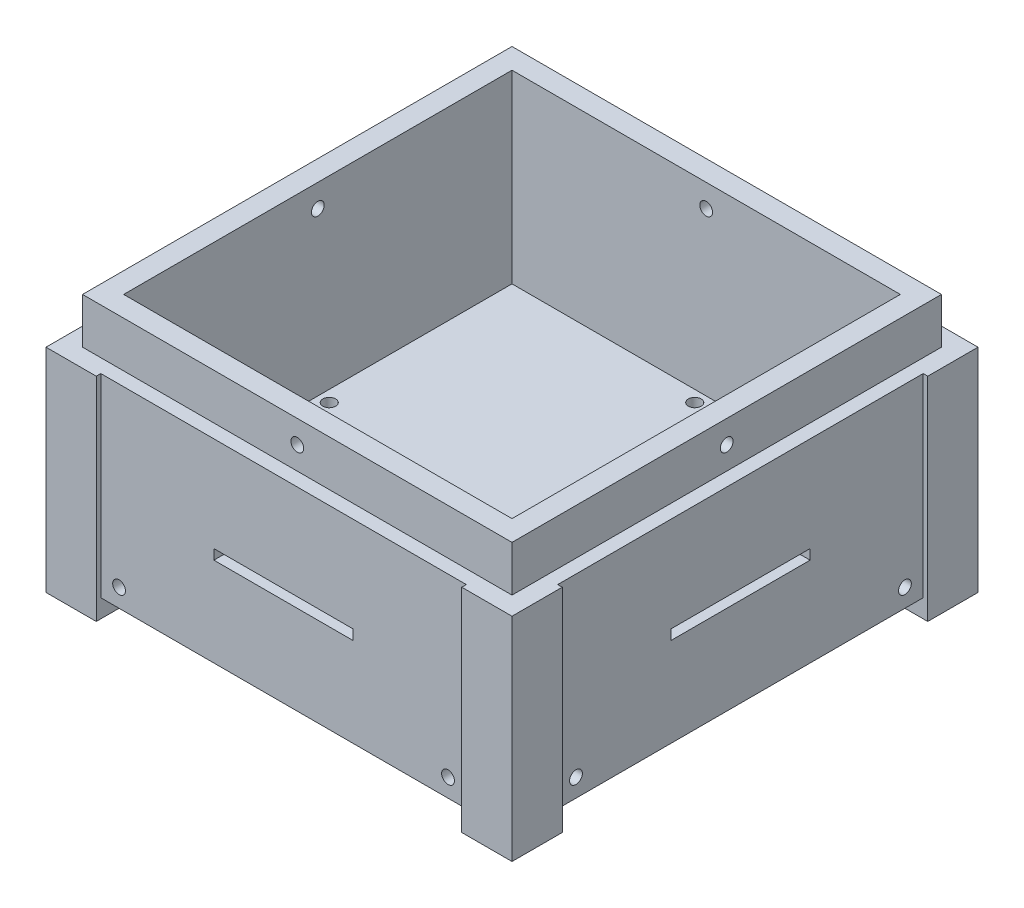
from build123d import *

# Parameters (mm, degrees)
SKETCH1_W                       = 100
SKETCH1_H                       = 100
BOSS_EXTRUDE1_DEPTH             = 95
SKETCH2_W                       = 10
SKETCH2_H                       = 10
BOSS_EXTRUDE2_DEPTH             = 105
SKETCH3_R                       = 1.4
CUT_EXTRUDE1_DEPTH              = 10
SKETCH4_W                       = 11
SKETCH4_H                       = 11
BOSS_EXTRUDE3_DEPTH             = 105
SKETCH5_R                       = 1.4
CUT_EXTRUDE2_DEPTH              = 10
SKETCH6_R                       = 1.4
CUT_EXTRUDE3_DEPTH              = 10
CHAMFER1_SIZE                   = 1
SKETCH7_W                       = 19
SKETCH7_H                       = 43
SKETCH7_W_2                     = 16
SKETCH7_H_2                     = 40
BOSS_EXTRUDE4_DEPTH             = 3
SKETCH8_W                       = 16
SKETCH8_H                       = 40
CUT_EXTRUDE4_DEPTH              = 10
CHAMFER2_SIZE                   = 13
SKETCH9_W                       = 16
SKETCH9_H                       = 3.1
CUT_EXTRUDE5_DEPTH              = 10
FILLET1_R                       = 1
SKETCH10_R                      = 1.4
CUT_EXTRUDE6_DEPTH              = 10
SKETCH12_W                      = 30.5
SKETCH12_H                      = 2.2
CUT_EXTRUDE7_DEPTH              = 3
SKETCH13_W                      = 30.5
SKETCH13_H                      = 2.2
CUT_EXTRUDE8_DEPTH              = 3
SKETCH14_W                      = 2.2
SKETCH14_H                      = 30.5
CUT_EXTRUDE9_DEPTH              = 3
CUT_EXTRUDE10_DEPTH             = 45
CUT_EXTRUDE10_DEPTH_BACK        = 45
SKETCH15_W                      = 90
SKETCH15_H                      = 58
CUT_EXTRUDE11_REACH             = 125.296
CUT_EXTRUDE11_DIRECTION_2_REACH = 125.296
CHAMFER3_SIZE                   = 4
CUT_EXTRUDE12_DEPTH             = 152.673992497
BOSS_EXTRUDE7_DEPTH             = 10
BOSS_EXTRUDE7_DEPTH_BACK        = 30.5
SKETCH19_W                      = 94
SKETCH19_H                      = 94
SKETCH19_W_2                    = 85
SKETCH19_H_2                    = 85
SKETCH20_R                      = 1.4
CUT_EXTRUDE13_DEPTH             = 123.316188626
SKETCH21_R                      = 1.4
CUT_EXTRUDE14_DEPTH             = 123.316188626
SKETCH22_W                      = 2.2
SKETCH22_H                      = 30.5
BOSS_EXTRUDE8_DEPTH             = 3
SKETCH23_R                      = 1.4
CUT_EXTRUDE15_DEPTH             = 20


with BuildPart() as part:
    # Sketch1 → Boss-Extrude1 (new body)
    with BuildSketch(Plane(origin=(0, 0, 0), x_dir=(1, 0, 0), z_dir=(0, 1, 0))):
        Rectangle(SKETCH1_W, SKETCH1_H)
    extrude(amount=BOSS_EXTRUDE1_DEPTH)

    # Sketch2 → Boss-Extrude2 (add)
    with BuildSketch(Plane(origin=(0, 100, 0), x_dir=(1, 0, 0), z_dir=(0, 1, 0))):
        with Locations((-45, 45)):
            Rectangle(SKETCH2_W, SKETCH2_H)
        with Locations((45, 45)):
            Rectangle(SKETCH2_W, SKETCH2_H)
        with Locations((45, -45)):
            Rectangle(SKETCH2_W, SKETCH2_H)
        with Locations((-45, -45)):
            Rectangle(SKETCH2_W, SKETCH2_H)
    extrude(amount=-BOSS_EXTRUDE2_DEPTH)

    # Sketch3 → Cut-Extrude1 (cut)
    with BuildSketch(Plane(origin=(0, 95, 0), x_dir=(1, 0, 0), z_dir=(0, 1, 0))):
        with Locations(Location((-28, -45, 0), (0, 0, 270))):
            Circle(SKETCH3_R)
        with Locations(Location((28, -45, 0), (0, 0, 90))):
            Circle(SKETCH3_R)
        with Locations(Location((28, 45, 0), (0, 0, 270))):
            Circle(SKETCH3_R)
        with Locations(Location((-28, 45, 0), (0, 0, 90))):
            Circle(SKETCH3_R)
    cut_extrude1 = extrude(amount=-CUT_EXTRUDE1_DEPTH, mode=Mode.SUBTRACT)

    # Sketch4 → Boss-Extrude3 (add)
    with BuildSketch(Plane(origin=(0, 100, 0), x_dir=(1, 0, 0), z_dir=(0, 1, 0))):
        with Locations((-45.5, 45.5)):
            Rectangle(SKETCH4_W, SKETCH4_H)
        with Locations((45.5, 45.5)):
            Rectangle(SKETCH4_W, SKETCH4_H)
        with Locations((45.5, -45.5)):
            Rectangle(SKETCH4_W, SKETCH4_H)
        with Locations((-45.5, -45.5)):
            Rectangle(SKETCH4_W, SKETCH4_H)
    extrude(amount=-BOSS_EXTRUDE3_DEPTH)

    # Sketch5 → Cut-Extrude2 (cut)
    with BuildSketch(Plane.XY.offset(50)):
        with Locations((-36, 91)):
            Circle(SKETCH5_R)
        with Locations(Location((36, 91, 0), (0, 0, 180))):
            Circle(SKETCH5_R)
        with Locations((36, 4)):
            Circle(SKETCH5_R)
        with Locations(Location((-36, 4, 0), (0, 0, 180))):
            Circle(SKETCH5_R)
    cut_extrude2 = extrude(amount=-CUT_EXTRUDE2_DEPTH, mode=Mode.SUBTRACT)

    # Mirror1: Cut-Extrude2 across plane
    add(cut_extrude2.mirror(Plane.XY), mode=Mode.SUBTRACT)

    # Sketch6 → Cut-Extrude3 (cut)
    with BuildSketch(Plane.ZY.offset(50)):
        with Locations((-36, 91)):
            Circle(SKETCH6_R)
        with Locations(Location((36, 91, 0), (0, 0, 180))):
            Circle(SKETCH6_R)
        with Locations((36, 4)):
            Circle(SKETCH6_R)
        with Locations(Location((-36, 4, 0), (0, 0, 180))):
            Circle(SKETCH6_R)
    cut_extrude3 = extrude(amount=-CUT_EXTRUDE3_DEPTH, mode=Mode.SUBTRACT)

    # Mirror2: Cut-Extrude3 across plane
    add(cut_extrude3.mirror(Plane(origin=(0, 0, 0), x_dir=(0, 0, 1), z_dir=(1, 0, 0))), mode=Mode.SUBTRACT)

    # Mirror3: Cut-Extrude1 across plane
    add(cut_extrude1.mirror(Plane.ZX.offset(47.5)), mode=Mode.SUBTRACT)

    # Chamfer1
    chamfer1_edges = [part.edges().sort_by_distance(p)[0] for p in [
        (-45.5, -5, 51),
        (-51, -5, 45.5),
        (-51, 100, 45.5),
        (-45.5, 100, 51),
        (51, -5, 45.5),
        (45.5, -5, 51),
        (45.5, 100, 51),
        (51, 100, 45.5),
        (45.5, -5, -51),
        (51, -5, -45.5),
        (51, 100, -45.5),
        (45.5, 100, -51),
        (-51, -5, -45.5),
        (-45.5, -5, -51),
        (-45.5, 100, -51),
        (-51, 100, -45.5),
        (-45.5, -5, 40),
        (-40, -5, 45.5),
        (-40, 100, 45.5),
        (-45.5, 100, 40),
        (40, -5, 45.5),
        (45.5, -5, 40),
        (45.5, 100, 40),
        (40, 100, 45.5),
        (45.5, -5, -40),
        (40, -5, -45.5),
        (45, 95, -40),
        (40, 100, -45.5),
        (45.5, 100, -40),
        (-40, -5, -45.5),
        (-45.5, -5, -40),
        (-45.5, 100, -40),
        (-40, 100, -45.5),
    ]]
    chamfer(chamfer1_edges, length=CHAMFER1_SIZE)

    # Sketch7 → Boss-Extrude4 (add)
    with BuildSketch(Plane(origin=(0, 95, 0), x_dir=(1, 0, 0), z_dir=(0, 1, 0))):
        with Locations((0, -17)):
            Rectangle(SKETCH7_W, SKETCH7_H)
        with Locations((0, -17)):
            Rectangle(SKETCH7_W_2, SKETCH7_H_2, mode=Mode.SUBTRACT)
    extrude(amount=BOSS_EXTRUDE4_DEPTH)

    # Sketch8 → Cut-Extrude4 (cut)
    with BuildSketch(Plane(origin=(0, 95, 0), x_dir=(1, 0, 0), z_dir=(0, 1, 0))):
        with Locations((0, -17)):
            Rectangle(SKETCH8_W, SKETCH8_H)
    extrude(amount=-CUT_EXTRUDE4_DEPTH, mode=Mode.SUBTRACT)

    # Chamfer2
    chamfer2_edges = [part.edges().sort_by_distance(p)[0] for p in [
        (0, 85, 37),
    ]]
    chamfer(chamfer2_edges, length=CHAMFER2_SIZE - 0.0001)  # a hair under: the kernel refuses the full size

    # Sketch9 → Cut-Extrude5 (cut)
    with BuildSketch(Plane(origin=(0, 85, 0), x_dir=(1, 0, 0), z_dir=(0, 1, 0))):
        with Locations((0, 1.45)):
            Rectangle(SKETCH9_W, SKETCH9_H)
    extrude(amount=-CUT_EXTRUDE5_DEPTH, mode=Mode.SUBTRACT)

    # Fillet1
    fillet1_edges = [part.edges().sort_by_distance(p)[0] for p in [
        (0, 85, 0.1),
    ]]
    fillet(fillet1_edges, radius=FILLET1_R)

    # Sketch10 → Cut-Extrude6 (cut)
    with BuildSketch(Plane.XY.offset(-3)):
        with Locations((0, 92)):
            Circle(SKETCH10_R)
    extrude(amount=-CUT_EXTRUDE6_DEPTH, mode=Mode.SUBTRACT)

    # Sketch12 → Cut-Extrude7 (cut)
    with BuildSketch(Plane.ZY.offset(50)):
        with Locations((0, 74.4)):
            Rectangle(SKETCH12_W, SKETCH12_H)
        with Locations((0, 20.6)):
            Rectangle(SKETCH12_W, SKETCH12_H)
    cut_extrude7 = extrude(amount=-CUT_EXTRUDE7_DEPTH, mode=Mode.SUBTRACT)

    # Mirror4: Cut-Extrude7 across plane
    add(cut_extrude7.mirror(Plane(origin=(0, 0, 0), x_dir=(0, 0, 1), z_dir=(1, 0, 0))), mode=Mode.SUBTRACT)

    # Sketch13 → Cut-Extrude8 (cut)
    with BuildSketch(Plane.XY.offset(50)):
        with Locations((0, 74.4)):
            Rectangle(SKETCH13_W, SKETCH13_H)
        with Locations((0, 20.6)):
            Rectangle(SKETCH13_W, SKETCH13_H)
    cut_extrude8 = extrude(amount=-CUT_EXTRUDE8_DEPTH, mode=Mode.SUBTRACT)

    # Mirror5: Cut-Extrude8 across plane
    add(cut_extrude8.mirror(Plane.XY), mode=Mode.SUBTRACT)

    # Sketch14 → Cut-Extrude9 (cut)
    with BuildSketch(Plane(origin=(0, 95, 0), x_dir=(1, 0, 0), z_dir=(0, 1, 0))):
        with Locations((26.9, 0)):
            Rectangle(SKETCH14_W, SKETCH14_H)
        with Locations((-26.9, 0)):
            Rectangle(SKETCH14_W, SKETCH14_H)
    cut_extrude9 = extrude(amount=-CUT_EXTRUDE9_DEPTH, mode=Mode.SUBTRACT)

    # Mirror6: Cut-Extrude9 across plane
    add(cut_extrude9.mirror(Plane.ZX.offset(47.5)), mode=Mode.SUBTRACT)

    # Sketch15 → Cut-Extrude10 (cut, two sides: drawn at the far end of the back side and taken through both)
    with BuildSketch(Plane(origin=(0, 0, 0), x_dir=(0, 0, -1), z_dir=(1, 0, 0)).offset(-CUT_EXTRUDE10_DEPTH_BACK)):
        with Locations((0, 41)):
            Rectangle(SKETCH15_W, SKETCH15_H)
    extrude(amount=CUT_EXTRUDE10_DEPTH + CUT_EXTRUDE10_DEPTH_BACK, mode=Mode.SUBTRACT)

    # Cut-Extrude11: up to this face of the body (flat: up to its plane)
    cut_extrude11_end = Plane(part.part.faces().sort_by_distance((0, 41, 45))[0])
    # Sketch16 → Cut-Extrude11 (cut, up to the picked face)
    with BuildSketch(Plane.XY, mode=Mode.PRIVATE) as cut_extrude11_sk1:
        Polygon((45, 57.006357685), (-45, 57.006357685), (-45, 83), (-13, 83), (-13, 67.006357685), (13, 67.006357685), (13, 83), (45, 83), align=None)
    cut_extrude11_tool1 = split(extrude(cut_extrude11_sk1.sketch, amount=CUT_EXTRUDE11_REACH, mode=Mode.PRIVATE), bisect_by=cut_extrude11_end, keep=Keep.BOTH, mode=Mode.PRIVATE)
    add(cut_extrude11_tool1.solids().sort_by(Axis((0, 57.943143, 0), (0, 0, 1)))[0], mode=Mode.SUBTRACT)

    # Cut-Extrude11 direction 2: up to this face of the body (flat: up to its plane)
    cut_extrude11_direction_2_end = Plane(part.part.faces().sort_by_distance((0, 41, -45))[0])
    # Sketch16 → Cut-Extrude11 direction 2 (cut, up to the picked face)
    with BuildSketch(Plane.XY, mode=Mode.PRIVATE) as cut_extrude11_direction_2_sk1:
        Polygon((45, 57.006357685), (-45, 57.006357685), (-45, 83), (-13, 83), (-13, 67.006357685), (13, 67.006357685), (13, 83), (45, 83), align=None)
    cut_extrude11_direction_2_tool1 = split(extrude(cut_extrude11_direction_2_sk1.sketch, amount=-CUT_EXTRUDE11_DIRECTION_2_REACH, mode=Mode.PRIVATE), bisect_by=cut_extrude11_direction_2_end, keep=Keep.BOTH, mode=Mode.PRIVATE)
    add(cut_extrude11_direction_2_tool1.solids().sort_by(Axis((0, 57.943143, 0), (0, 0, -1)))[0], mode=Mode.SUBTRACT)

    # Chamfer3
    chamfer3_edges = [part.edges().sort_by_distance(p)[0] for p in [
        (13, 70, 0),
        (-13, 70, 0),
    ]]
    chamfer(chamfer3_edges, length=CHAMFER3_SIZE)

    # Sketch17 → Cut-Extrude12 (cut, through all)
    with BuildSketch(Plane(origin=(0, 0, -51), x_dir=(-1, 0, 0), z_dir=(0, 0, -1))):
        Polygon((-51, 47.5), (-51, 104.912758391), (51, 104.912758391), (51, 47.5), (51, 42.5), (-51, 42.5), align=None)
    extrude(amount=-CUT_EXTRUDE12_DEPTH, mode=Mode.SUBTRACT)

    # Sketch19 → Boss-Extrude7 (add, two sides: drawn at the far end of the back side and taken through both)
    with BuildSketch(Plane(origin=(0, 42.5, 0), x_dir=(1, 0, 0), z_dir=(0, 1, 0)).offset(-BOSS_EXTRUDE7_DEPTH_BACK)):
        Rectangle(SKETCH19_W, SKETCH19_H)
        Rectangle(SKETCH19_W_2, SKETCH19_H_2, mode=Mode.SUBTRACT)
    extrude(amount=BOSS_EXTRUDE7_DEPTH + BOSS_EXTRUDE7_DEPTH_BACK)

    # Sketch20 → Cut-Extrude13 (cut, through all)
    with BuildSketch(Plane.XY.offset(47)):
        with Locations((0, 47.5)):
            Circle(SKETCH20_R)
    extrude(amount=-CUT_EXTRUDE13_DEPTH, mode=Mode.SUBTRACT)

    # Sketch21 → Cut-Extrude14 (cut, through all)
    with BuildSketch(Plane(origin=(47, 0, 0), x_dir=(0, 0, -1), z_dir=(1, 0, 0))):
        with Locations((0, 47.5)):
            Circle(SKETCH21_R)
    extrude(amount=-CUT_EXTRUDE14_DEPTH, mode=Mode.SUBTRACT)

    # Sketch22 → Boss-Extrude8 (add)
    with BuildSketch(Plane.XZ):
        with Locations((26.9, 0)):
            Rectangle(SKETCH22_W, SKETCH22_H)
        with Locations((-26.9, 0)):
            Rectangle(SKETCH22_W, SKETCH22_H)
    extrude(amount=-BOSS_EXTRUDE8_DEPTH)

    # Sketch23 → Cut-Extrude15 (cut)
    with BuildSketch(Plane.XZ):
        with Locations(Location((-40, 0, 0), (0, 0, 270))):
            Circle(SKETCH23_R)
        with Locations(Location((0, 40, 0), (0, 0, 270))):
            Circle(SKETCH23_R)
        with Locations(Location((40, 0, 0), (0, 0, 270))):
            Circle(SKETCH23_R)
        with Locations(Location((0, -40, 0), (0, 0, 270))):
            Circle(SKETCH23_R)
    extrude(amount=-CUT_EXTRUDE15_DEPTH, mode=Mode.SUBTRACT)


solid = part.part
